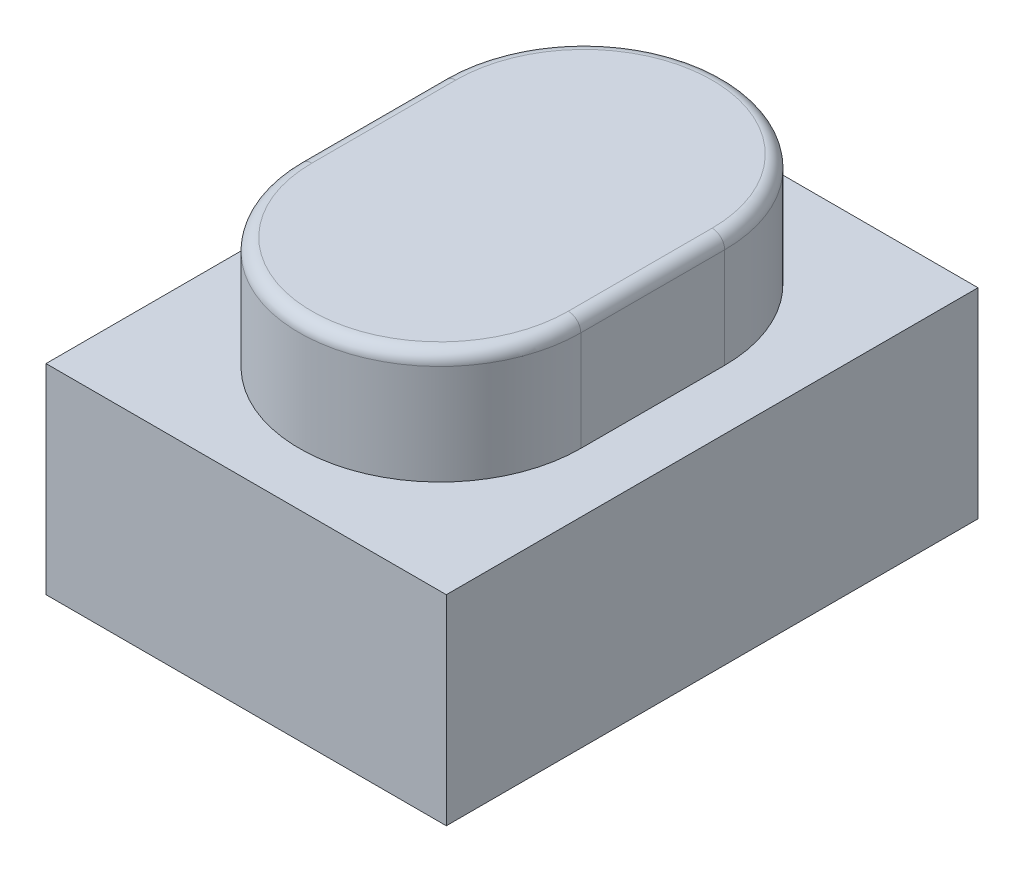
from build123d import *

# Parameters (mm, degrees)
BASES_W      = 3.2
BASES_H      = 4.25
BASE_DEPTH   = 1.6
BUTTON_DEPTH = 0.9
BF_R         = 0.1


with BuildPart() as part:
    # BaseS → Base (new body)
    with BuildSketch(Plane(origin=(0, 0, 0), x_dir=(1, 0, 0), z_dir=(0, 1, 0))):
        Rectangle(BASES_W, BASES_H)
    extrude(amount=BASE_DEPTH)

    # ButtonS → Button (add)
    with BuildSketch(Plane(origin=(0, 1.6, 0), x_dir=(1, 0, 0), z_dir=(0, 1, 0))):
        with BuildLine():
            Line((1.125, 0.575), (1.125, -0.575))
            ThreePointArc((1.125, -0.575), (0, -1.7), (-1.125, -0.575))
            Line((-1.125, -0.575), (-1.125, 0.575))
            ThreePointArc((-1.125, 0.575), (0, 1.7), (1.125, 0.575))
        make_face()
    extrude(amount=BUTTON_DEPTH)

    # BF
    bf_edges = [part.edges().sort_by_distance(p)[0] for p in [
        (1.125, 2.5, 0),
        (0, 2.5, 1.7),
        (-1.125, 2.5, 0),
        (0, 2.5, -1.7),
    ]]
    fillet(bf_edges, radius=BF_R)


solid = part.part
